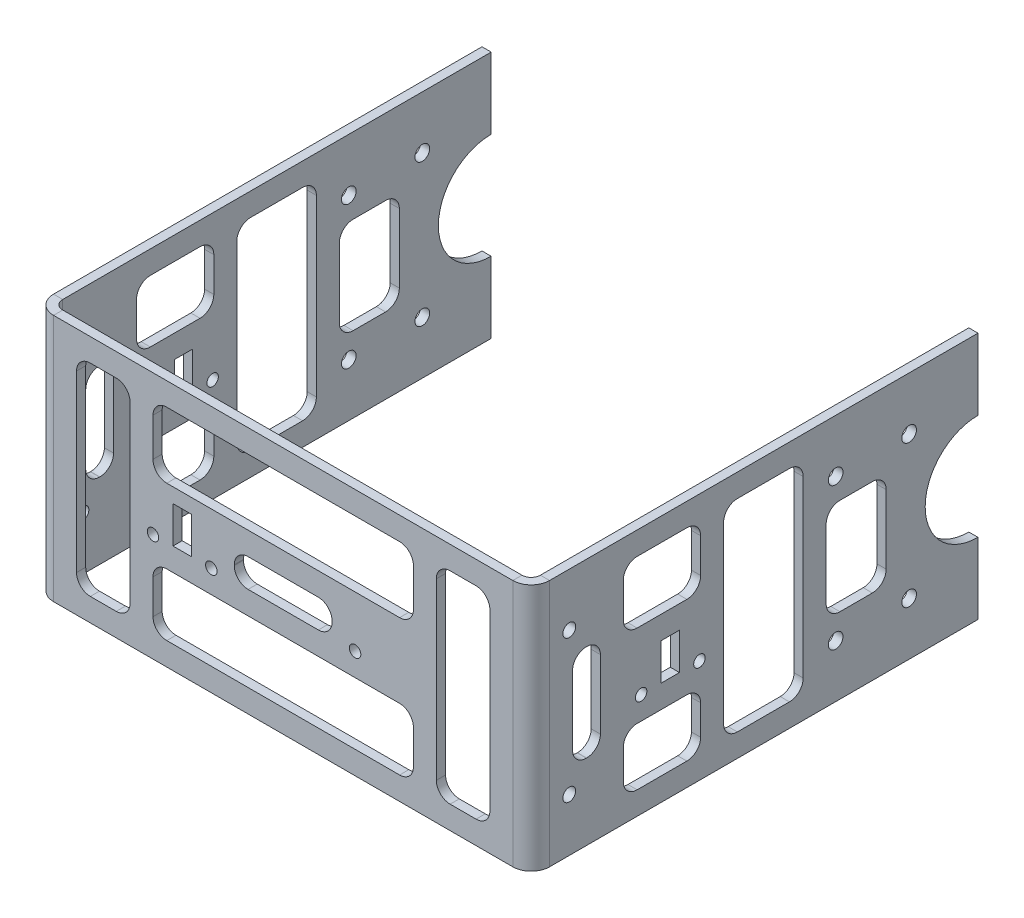
from build123d import *

# Parameters (mm, degrees)
SZKIC1_R                        = 1.6
SZKIC1_R_2                      = 1.25
SZKIC1_R_3                      = 1.4
SZKIC1_W                        = 4
SZKIC1_H                        = 8
DODANIE_WYCI_GNI_CIE2_DEPTH     = 2
SZKIC_START                     = -157.387814563
SZKIC_ZGI_CIA9_OUTLINE_W        = 54
SZKIC_ZGI_CIA9_OUTLINE_H        = 2
SZKIC_ZGI_CIA9_DEPTH            = 94.41096
SZKIC_START_2                   = -61.410294563
SZKIC_ZGI_CIA9_2_OUTLINE_R      = 1.6
SZKIC_ZGI_CIA9_2_OUTLINE_R_2    = 1.25
SZKIC_ZGI_CIA9_2_OUTLINE_W      = 8
SZKIC_ZGI_CIA9_2_OUTLINE_H      = 4
SZKIC_ZGI_CIA9_2_OUTLINE_R_3    = 1.4
SZKIC_ZGI_CIA9_2_DEPTH          = 0.02248
SZKIC_START_3                   = -63.387814563
SZKIC_ZGI_CIA9_3_OUTLINE_R      = 1.6
SZKIC_ZGI_CIA9_3_OUTLINE_R_2    = 1.25
SZKIC_ZGI_CIA9_3_OUTLINE_W      = 8
SZKIC_ZGI_CIA9_3_OUTLINE_H      = 4
SZKIC_ZGI_CIA9_3_OUTLINE_R_3    = 1.4
SZKIC_ZGI_CIA9_3_DEPTH          = 4
SZKIC_START_4                   = -28.35389443
SZKIC_ZGI_CIA9_4_DEPTH          = 54
SZKIC_START_5                   = 44.189705437
SZKIC_ZGI_CIA10_OUTLINE_W       = 54
SZKIC_ZGI_CIA10_OUTLINE_H       = 2
SZKIC_ZGI_CIA10_DEPTH           = 94.42248
SZKIC_START_6                   = 40.612185437
SZKIC_ZGI_CIA10_2_OUTLINE_R     = 1.6
SZKIC_ZGI_CIA10_2_OUTLINE_R_2   = 1.25
SZKIC_ZGI_CIA10_2_OUTLINE_W     = 8
SZKIC_ZGI_CIA10_2_OUTLINE_H     = 4
SZKIC_ZGI_CIA10_2_OUTLINE_R_3   = 1.4
SZKIC_ZGI_CIA10_2_DEPTH         = 4
SZKIC_ZGI_CIA10_3_DEPTH         = 54
WYTNIJ_WYCI_GNI_CIE1_DEPTH      = 3
WYTNIJ_WYCI_GNI_CIE2_DEPTH      = 147.791253634
WYTNIJ_WYCI_GNI_CIE2_DEPTH_BACK = 147.791253634


with BuildPart() as part:
    # Szkic1 → Dodanie-wyciągnięcie2 (new body)
    with BuildSketch(Plane.XY):
        with BuildLine():
            Line((-157.387814563, 25.64610557), (-157.387814563, 10.14610557))
            ThreePointArc((-157.387814563, 10.14610557), (-145.887814563, -1.35389443), (-157.387814563, -12.85389443))
            Line((-157.387814563, -12.85389443), (-157.387814563, -28.35389443))
            Line((-157.387814563, -28.35389443), (-54.387814563, -28.35389443))
            Line((-54.387814563, -28.35389443), (35.612185437, -28.35389443))
            Line((35.612185437, -28.35389443), (138.612185437, -28.35389443))
            Line((138.612185437, -28.35389443), (138.612185437, -12.85389443))
            ThreePointArc((138.612185437, -12.85389443), (127.112185437, -1.35389443), (138.612185437, 10.14610557))
            Line((138.612185437, 10.14610557), (138.612185437, 25.64610557))
            Line((138.612185437, 25.64610557), (-157.387814563, 25.64610557))
        make_face()
        with Locations((-126.387814563, -16.85389443)):
            Circle(SZKIC1_R, mode=Mode.SUBTRACT)
        with Locations((-126.387814563, 14.14610557)):
            Circle(SZKIC1_R, mode=Mode.SUBTRACT)
        with Locations((107.612185437, -16.85389443)):
            Circle(SZKIC1_R, mode=Mode.SUBTRACT)
        with Locations((107.612185437, 14.14610557)):
            Circle(SZKIC1_R, mode=Mode.SUBTRACT)
        with Locations((123.612185437, -16.85389443)):
            Circle(SZKIC1_R, mode=Mode.SUBTRACT)
        with Locations((123.612185437, 14.14610557)):
            Circle(SZKIC1_R, mode=Mode.SUBTRACT)
        with Locations((-142.387814563, -16.85389443)):
            Circle(SZKIC1_R, mode=Mode.SUBTRACT)
        with Locations((-142.387814563, 14.14610557)):
            Circle(SZKIC1_R, mode=Mode.SUBTRACT)
        with Locations((-37.737814563, -4.85389443)):
            Circle(SZKIC1_R_2, mode=Mode.SUBTRACT)
        with Locations((-25.037814563, -4.85389443)):
            Circle(SZKIC1_R_2, mode=Mode.SUBTRACT)
        with Locations((6.262185437, -4.85389443)):
            Circle(SZKIC1_R_2, mode=Mode.SUBTRACT)
        with Locations((65.262185437, -5.85389443)):
            Circle(SZKIC1_R_2, mode=Mode.SUBTRACT)
        with Locations((77.962185437, -5.85389443)):
            Circle(SZKIC1_R_2, mode=Mode.SUBTRACT)
        with Locations((-96.737814563, -5.85389443)):
            Circle(SZKIC1_R_2, mode=Mode.SUBTRACT)
        with Locations((-84.037814563, -5.85389443)):
            Circle(SZKIC1_R_2, mode=Mode.SUBTRACT)
        with Locations((-68.387814563, -16.85389443)):
            Circle(SZKIC1_R_3, mode=Mode.SUBTRACT)
        with Locations((-68.387814563, 14.14610557)):
            Circle(SZKIC1_R_3, mode=Mode.SUBTRACT)
        with Locations((49.612185437, -16.85389443)):
            Circle(SZKIC1_R_3, mode=Mode.SUBTRACT)
        with Locations((49.612185437, 14.14610557)):
            Circle(SZKIC1_R_3, mode=Mode.SUBTRACT)
        with Locations((-31.387814563, -0.85389443)):
            Rectangle(SZKIC1_W, SZKIC1_H, mode=Mode.SUBTRACT)
        with Locations((71.612185437, -1.85389443)):
            Rectangle(SZKIC1_W, SZKIC1_H, mode=Mode.SUBTRACT)
        with Locations((-90.387814563, -1.85389443)):
            Rectangle(SZKIC1_W, SZKIC1_H, mode=Mode.SUBTRACT)
    extrude(amount=DODANIE_WYCI_GNI_CIE2_DEPTH)

    # Szkic zgięcia9: read off the stored shape, not the designer's step
    # Szkic zgięcia9 outline → Szkic zgięcia9 (cut)
    with BuildSketch(Plane.YZ.offset(SZKIC_START)):
        with Locations((-1.35389443, 1)):
            Rectangle(SZKIC_ZGI_CIA9_OUTLINE_W, SZKIC_ZGI_CIA9_OUTLINE_H)
    extrude(amount=SZKIC_ZGI_CIA9_DEPTH, mode=Mode.SUBTRACT)

    # Szkic zgi_cia9 2 outline → Szkic zgi_cia9 2 (add)
    with BuildSketch(Plane.YZ.offset(SZKIC_START_2)):
        with BuildLine():
            Line((-28.35389443, 0), (-28.35389443, -95.28761102))
            Line((-28.35389443, -95.28761102), (-12.85389443, -95.28761102))
            ThreePointArc((-12.85389443, -95.28761102), (-1.35389443, -83.78761102), (10.14610557, -95.28761102))
            Line((10.14610557, -95.28761102), (25.64610557, -95.28761102))
            Line((25.64610557, -95.28761102), (25.64610557, 0))
            Line((25.64610557, 0), (-28.35389443, 0))
        make_face()
        with Locations((-16.85389443, -80.28761102)):
            Circle(SZKIC_ZGI_CIA9_2_OUTLINE_R, mode=Mode.SUBTRACT)
        with Locations((-16.85389443, -64.28761102)):
            Circle(SZKIC_ZGI_CIA9_2_OUTLINE_R, mode=Mode.SUBTRACT)
        with Locations((14.14610557, -80.28761102)):
            Circle(SZKIC_ZGI_CIA9_2_OUTLINE_R, mode=Mode.SUBTRACT)
        with Locations((14.14610557, -64.28761102)):
            Circle(SZKIC_ZGI_CIA9_2_OUTLINE_R, mode=Mode.SUBTRACT)
        with Locations((-5.85389443, -34.63761102)):
            Circle(SZKIC_ZGI_CIA9_2_OUTLINE_R_2, mode=Mode.SUBTRACT)
        with Locations((-1.85389443, -28.28761102)):
            Rectangle(SZKIC_ZGI_CIA9_2_OUTLINE_W, SZKIC_ZGI_CIA9_2_OUTLINE_H, mode=Mode.SUBTRACT)
        with Locations((-16.85389443, -6.28761102)):
            Circle(SZKIC_ZGI_CIA9_2_OUTLINE_R_3, mode=Mode.SUBTRACT)
        with Locations((-5.85389443, -21.93761102)):
            Circle(SZKIC_ZGI_CIA9_2_OUTLINE_R_2, mode=Mode.SUBTRACT)
        with Locations((14.14610557, -6.28761102)):
            Circle(SZKIC_ZGI_CIA9_2_OUTLINE_R_3, mode=Mode.SUBTRACT)
    extrude(amount=SZKIC_ZGI_CIA9_2_DEPTH)

    # Szkic zgi_cia9 3 outline → Szkic zgi_cia9 3 (add)
    with BuildSketch(Plane.YZ.offset(SZKIC_START_3)):
        with BuildLine():
            Line((-28.35389443, 0), (-28.35389443, -95.28761102))
            Line((-28.35389443, -95.28761102), (-12.85389443, -95.28761102))
            ThreePointArc((-12.85389443, -95.28761102), (-1.35389443, -83.78761102), (10.14610557, -95.28761102))
            Line((10.14610557, -95.28761102), (25.64610557, -95.28761102))
            Line((25.64610557, -95.28761102), (25.64610557, 0))
            Line((25.64610557, 0), (-28.35389443, 0))
        make_face()
        with Locations((-16.85389443, -80.28761102)):
            Circle(SZKIC_ZGI_CIA9_3_OUTLINE_R, mode=Mode.SUBTRACT)
        with Locations((-16.85389443, -64.28761102)):
            Circle(SZKIC_ZGI_CIA9_3_OUTLINE_R, mode=Mode.SUBTRACT)
        with Locations((14.14610557, -80.28761102)):
            Circle(SZKIC_ZGI_CIA9_3_OUTLINE_R, mode=Mode.SUBTRACT)
        with Locations((14.14610557, -64.28761102)):
            Circle(SZKIC_ZGI_CIA9_3_OUTLINE_R, mode=Mode.SUBTRACT)
        with Locations((-5.85389443, -34.63761102)):
            Circle(SZKIC_ZGI_CIA9_3_OUTLINE_R_2, mode=Mode.SUBTRACT)
        with Locations((-1.85389443, -28.28761102)):
            Rectangle(SZKIC_ZGI_CIA9_3_OUTLINE_W, SZKIC_ZGI_CIA9_3_OUTLINE_H, mode=Mode.SUBTRACT)
        with Locations((-16.85389443, -6.28761102)):
            Circle(SZKIC_ZGI_CIA9_3_OUTLINE_R_3, mode=Mode.SUBTRACT)
        with Locations((-5.85389443, -21.93761102)):
            Circle(SZKIC_ZGI_CIA9_3_OUTLINE_R_2, mode=Mode.SUBTRACT)
        with Locations((14.14610557, -6.28761102)):
            Circle(SZKIC_ZGI_CIA9_3_OUTLINE_R_3, mode=Mode.SUBTRACT)
    extrude(amount=SZKIC_ZGI_CIA9_3_DEPTH)

    # Szkic zgi_cia9 4 outline → Szkic zgi_cia9 4 (cut)
    with BuildSketch(Plane(origin=(0, 0, 0), x_dir=(1, 0, 0), z_dir=(0, 1, 0)).offset(SZKIC_START_4)):
        with BuildLine():
            Line((-59.387814563, 95.28761102), (-61.387814563, 95.28761102))
            Line((-61.387814563, 95.28761102), (-61.387814563, 2))
            ThreePointArc((-61.387814563, 2), (-60.802028126, 0.585786437), (-59.387814563, 0))
            Line((-59.387814563, 0), (-59.387814563, 95.28761102))
        make_face()
        with BuildLine():
            ThreePointArc((-59.387814563, -2), (-62.216241688, -0.828427125), (-63.387814563, 2))
            Line((-63.387814563, 2), (-63.387814563, 0))
            Line((-63.387814563, 0), (-62.976854563, 0))
            Line((-62.976854563, 0), (-62.976854563, -2))
            Line((-62.976854563, -2), (-59.387814563, -2))
        make_face()
    extrude(amount=SZKIC_ZGI_CIA9_4_DEPTH, mode=Mode.SUBTRACT)

    # Szkic zgięcia10: read off the stored shape, not the designer's step
    # Szkic zgięcia10 outline → Szkic zgięcia10 (cut)
    with BuildSketch(Plane.YZ.offset(SZKIC_START_5)):
        with Locations((-1.35389443, 1)):
            Rectangle(SZKIC_ZGI_CIA10_OUTLINE_W, SZKIC_ZGI_CIA10_OUTLINE_H)
    extrude(amount=SZKIC_ZGI_CIA10_DEPTH, mode=Mode.SUBTRACT)

    # Szkic zgi_cia10 2 outline → Szkic zgi_cia10 2 (add)
    with BuildSketch(Plane.YZ.offset(SZKIC_START_6)):
        with BuildLine():
            Line((25.64610557, 0), (-28.35389443, 0))
            Line((-28.35389443, 0), (-28.35389443, -95.28761102))
            Line((-28.35389443, -95.28761102), (-12.85389443, -95.28761102))
            ThreePointArc((-12.85389443, -95.28761102), (-1.35389443, -83.78761102), (10.14610557, -95.28761102))
            Line((10.14610557, -95.28761102), (25.64610557, -95.28761102))
            Line((25.64610557, -95.28761102), (25.64610557, 0))
        make_face()
        with Locations((-16.85389443, -80.28761102)):
            Circle(SZKIC_ZGI_CIA10_2_OUTLINE_R, mode=Mode.SUBTRACT)
        with Locations((-16.85389443, -64.28761102)):
            Circle(SZKIC_ZGI_CIA10_2_OUTLINE_R, mode=Mode.SUBTRACT)
        with Locations((14.14610557, -80.28761102)):
            Circle(SZKIC_ZGI_CIA10_2_OUTLINE_R, mode=Mode.SUBTRACT)
        with Locations((14.14610557, -64.28761102)):
            Circle(SZKIC_ZGI_CIA10_2_OUTLINE_R, mode=Mode.SUBTRACT)
        with Locations((-5.85389443, -34.63761102)):
            Circle(SZKIC_ZGI_CIA10_2_OUTLINE_R_2, mode=Mode.SUBTRACT)
        with Locations((-1.85389443, -28.28761102)):
            Rectangle(SZKIC_ZGI_CIA10_2_OUTLINE_W, SZKIC_ZGI_CIA10_2_OUTLINE_H, mode=Mode.SUBTRACT)
        with Locations((-16.85389443, -6.28761102)):
            Circle(SZKIC_ZGI_CIA10_2_OUTLINE_R_3, mode=Mode.SUBTRACT)
        with Locations((-5.85389443, -21.93761102)):
            Circle(SZKIC_ZGI_CIA10_2_OUTLINE_R_2, mode=Mode.SUBTRACT)
        with Locations((14.14610557, -6.28761102)):
            Circle(SZKIC_ZGI_CIA10_2_OUTLINE_R_3, mode=Mode.SUBTRACT)
    extrude(amount=SZKIC_ZGI_CIA10_2_DEPTH)

    # Szkic zgi_cia10 3 outline → Szkic zgi_cia10 3 (cut)
    with BuildSketch(Plane(origin=(0, 0, 0), x_dir=(1, 0, 0), z_dir=(0, 1, 0)).offset(SZKIC_START_4)):
        with BuildLine():
            ThreePointArc((44.612185437, 2), (43.440612562, -0.828427125), (40.612185437, -2))
            Line((40.612185437, -2), (44.189705437, -2))
            Line((44.189705437, -2), (44.189705437, 0))
            Line((44.189705437, 0), (44.612185437, 0))
            Line((44.612185437, 0), (44.612185437, 2))
        make_face()
        with BuildLine():
            ThreePointArc((40.612185437, 0), (42.026398999, 0.585786438), (42.612185437, 2))
            Line((42.612185437, 2), (42.612185437, 95.28761102))
            Line((42.612185437, 95.28761102), (40.612185437, 95.28761102))
            Line((40.612185437, 95.28761102), (40.612185437, 0))
        make_face()
    extrude(amount=SZKIC_ZGI_CIA10_3_DEPTH, mode=Mode.SUBTRACT)

    # Szkic35 → Wytnij-wyciągnięcie1 (cut)
    with BuildSketch(Plane.XY.offset(2)):
        with BuildLine():
            Line((32.612185437, -23.35389443), (26.962185437, -23.35389443))
            ThreePointArc((26.962185437, -23.35389443), (24.840865093, -22.475214774), (23.962185437, -20.35389443))
            Line((23.962185437, -20.35389443), (23.962185437, 17.64610557))
            ThreePointArc((23.962185437, 17.64610557), (24.840865093, 19.767425913), (26.962185437, 20.64610557))
            Line((26.962185437, 20.64610557), (32.612185437, 20.64610557))
            ThreePointArc((32.612185437, 20.64610557), (34.73350578, 19.767425913), (35.612185437, 17.64610557))
            Line((35.612185437, 17.64610557), (35.612185437, -20.35389443))
            ThreePointArc((35.612185437, -20.35389443), (34.73350578, -22.475214774), (32.612185437, -23.35389443))
        make_face()
        with BuildLine():
            Line((15.962185437, -23.35389443), (-34.737814563, -23.35389443))
            ThreePointArc((-34.737814563, -23.35389443), (-36.859134907, -22.475214774), (-37.737814563, -20.35389443))
            Line((-37.737814563, -20.35389443), (-37.737814563, -12.85389443))
            ThreePointArc((-37.737814563, -12.85389443), (-36.859134907, -10.732574087), (-34.737814563, -9.85389443))
            Line((-34.737814563, -9.85389443), (15.962185437, -9.85389443))
            ThreePointArc((15.962185437, -9.85389443), (18.08350578, -10.732574087), (18.962185437, -12.85389443))
            Line((18.962185437, -12.85389443), (18.962185437, -20.35389443))
            ThreePointArc((18.962185437, -20.35389443), (18.08350578, -22.475214774), (15.962185437, -23.35389443))
        make_face()
        with BuildLine():
            Line((15.962185437, 6.318796925), (-34.737814563, 6.318796925))
            ThreePointArc((-34.737814563, 6.318796925), (-36.859134907, 7.197476582), (-37.737814563, 9.318796925))
            Line((-37.737814563, 9.318796925), (-37.737814563, 17.64610557))
            ThreePointArc((-37.737814563, 17.64610557), (-36.859134907, 19.767425913), (-34.737814563, 20.64610557))
            Line((-34.737814563, 20.64610557), (15.962185437, 20.64610557))
            ThreePointArc((15.962185437, 20.64610557), (18.08350578, 19.767425913), (18.962185437, 17.64610557))
            Line((18.962185437, 17.64610557), (18.962185437, 9.318796925))
            ThreePointArc((18.962185437, 9.318796925), (18.08350578, 7.197476582), (15.962185437, 6.318796925))
        make_face()
        with BuildLine():
            Line((-1.737814563, -4.85389443), (-17.037814563, -4.85389443))
            ThreePointArc((-17.037814563, -4.85389443), (-19.159134907, -3.975214774), (-20.037814563, -1.85389443))
            Line((-20.037814563, -1.85389443), (-20.037814563, -1.681203075))
            ThreePointArc((-20.037814563, -1.681203075), (-19.159134907, 0.440117269), (-17.037814563, 1.318796925))
            Line((-17.037814563, 1.318796925), (-1.737814563, 1.318796925))
            ThreePointArc((-1.737814563, 1.318796925), (0.38350578, 0.440117269), (1.262185437, -1.681203075))
            Line((1.262185437, -1.681203075), (1.262185437, -1.85389443))
            ThreePointArc((1.262185437, -1.85389443), (0.38350578, -3.975214774), (-1.737814563, -4.85389443))
        make_face()
        with BuildLine():
            Line((-45.737814563, -23.35389443), (-51.387814563, -23.35389443))
            ThreePointArc((-51.387814563, -23.35389443), (-53.509134907, -22.475214774), (-54.387814563, -20.35389443))
            Line((-54.387814563, -20.35389443), (-54.387814563, 17.64610557))
            ThreePointArc((-54.387814563, 17.64610557), (-53.509134907, 19.767425913), (-51.387814563, 20.64610557))
            Line((-51.387814563, 20.64610557), (-45.737814563, 20.64610557))
            ThreePointArc((-45.737814563, 20.64610557), (-43.61649422, 19.767425913), (-42.737814563, 17.64610557))
            Line((-42.737814563, 17.64610557), (-42.737814563, -20.35389443))
            ThreePointArc((-42.737814563, -20.35389443), (-43.61649422, -22.475214774), (-45.737814563, -23.35389443))
        make_face()
    extrude(amount=-WYTNIJ_WYCI_GNI_CIE1_DEPTH, mode=Mode.SUBTRACT)

    # Szkic36 → Wytnij-wyciągnięcie2 (cut, two sides: drawn at the far end of the back side and taken through both)
    with BuildSketch(Plane.ZY.offset(63.387814563).offset(-WYTNIJ_WYCI_GNI_CIE2_DEPTH_BACK)):
        with BuildLine():
            Line((-54.225756634, 20.64610557), (-42.89162669, 20.64610557))
            ThreePointArc((-42.89162669, 20.64610557), (-40.770306346, 19.767425913), (-39.89162669, 17.64610557))
            Line((-39.89162669, 17.64610557), (-39.89162669, -20.35389443))
            ThreePointArc((-39.89162669, -20.35389443), (-40.770306346, -22.475214774), (-42.89162669, -23.35389443))
            Line((-42.89162669, -23.35389443), (-54.225756634, -23.35389443))
            ThreePointArc((-54.225756634, -23.35389443), (-56.347076977, -22.475214774), (-57.225756634, -20.35389443))
            Line((-57.225756634, -20.35389443), (-57.225756634, 17.64610557))
            ThreePointArc((-57.225756634, 17.64610557), (-56.347076977, 19.767425913), (-54.225756634, 20.64610557))
        make_face()
        with BuildLine():
            Line((-72.28761102, 9.14610557), (-65.225756634, 9.14610557))
            ThreePointArc((-65.225756634, 9.14610557), (-63.10443629, 8.267425913), (-62.225756634, 6.14610557))
            Line((-62.225756634, 6.14610557), (-62.225756634, -8.85389443))
            ThreePointArc((-62.225756634, -8.85389443), (-63.10443629, -10.975214774), (-65.225756634, -11.85389443))
            Line((-65.225756634, -11.85389443), (-72.28761102, -11.85389443))
            ThreePointArc((-72.28761102, -11.85389443), (-74.408931363, -10.975214774), (-75.28761102, -8.85389443))
            Line((-75.28761102, -8.85389443), (-75.28761102, 6.14610557))
            ThreePointArc((-75.28761102, 6.14610557), (-74.408931363, 8.267425913), (-72.28761102, 9.14610557))
        make_face()
        with BuildLine():
            Line((-31.89162669, 20.64610557), (-21.063119476, 20.64610557))
            ThreePointArc((-21.063119476, 20.64610557), (-18.941799132, 19.767425913), (-18.063119476, 17.64610557))
            Line((-18.063119476, 17.64610557), (-18.063119476, 10.14610557))
            ThreePointArc((-18.063119476, 10.14610557), (-18.941799132, 8.024785226), (-21.063119476, 7.14610557))
            Line((-21.063119476, 7.14610557), (-31.89162669, 7.14610557))
            ThreePointArc((-31.89162669, 7.14610557), (-34.012947033, 8.024785226), (-34.89162669, 10.14610557))
            Line((-34.89162669, 10.14610557), (-34.89162669, 17.64610557))
            ThreePointArc((-34.89162669, 17.64610557), (-34.012947033, 19.767425913), (-31.89162669, 20.64610557))
        make_face()
        with BuildLine():
            Line((-31.89162669, -10.85389443), (-21.063119476, -10.85389443))
            ThreePointArc((-21.063119476, -10.85389443), (-18.941799132, -11.732574087), (-18.063119476, -13.85389443))
            Line((-18.063119476, -13.85389443), (-18.063119476, -20.35389443))
            ThreePointArc((-18.063119476, -20.35389443), (-18.941799132, -22.475214774), (-21.063119476, -23.35389443))
            Line((-21.063119476, -23.35389443), (-31.89162669, -23.35389443))
            ThreePointArc((-31.89162669, -23.35389443), (-34.012947033, -22.475214774), (-34.89162669, -20.35389443))
            Line((-34.89162669, -20.35389443), (-34.89162669, -13.85389443))
            ThreePointArc((-34.89162669, -13.85389443), (-34.012947033, -11.732574087), (-31.89162669, -10.85389443))
        make_face()
        with BuildLine():
            Line((-10.063119476, 9.14610557), (-10, 9.14610557))
            ThreePointArc((-10, 9.14610557), (-7.878679656, 8.267425913), (-7, 6.14610557))
            Line((-7, 6.14610557), (-7, -8.85389443))
            ThreePointArc((-7, -8.85389443), (-7.878679656, -10.975214774), (-10, -11.85389443))
            Line((-10, -11.85389443), (-10.063119476, -11.85389443))
            ThreePointArc((-10.063119476, -11.85389443), (-12.184439819, -10.975214774), (-13.063119476, -8.85389443))
            Line((-13.063119476, -8.85389443), (-13.063119476, 6.14610557))
            ThreePointArc((-13.063119476, 6.14610557), (-12.184439819, 8.267425913), (-10.063119476, 9.14610557))
        make_face()
    extrude(amount=WYTNIJ_WYCI_GNI_CIE2_DEPTH + WYTNIJ_WYCI_GNI_CIE2_DEPTH_BACK, mode=Mode.SUBTRACT)


solid = part.part
